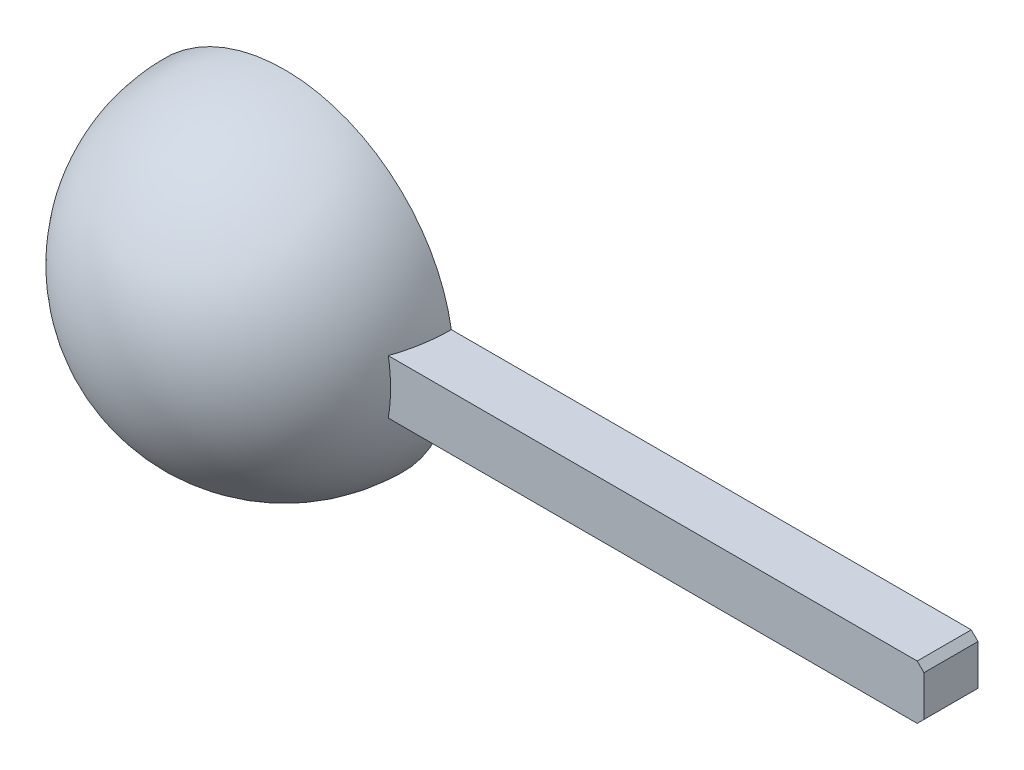
from build123d import *

# Parameters (mm, degrees)
R_VOLUTION1_ANGLE  = 180
COQUE1_T           = -2
ESQUISSE2_W        = 80
ESQUISSE2_H        = 8
BOSS_EXTRU_1_DEPTH = 8
CHANFREIN1_SIZE    = 1


with BuildPart() as part:
    # Esquisse1 → Révolution1 (revolve)
    with BuildSketch(Plane.XY):
        with BuildLine():
            Line((-25, 0), (25, 0))
            ThreePointArc((25, 0), (0, 25), (-25, 0))
        make_face()
    revolve(axis=Axis((-25, 0, 0), (1, 0, 0)), revolution_arc=R_VOLUTION1_ANGLE)

    # Coque1
    coque1_openings = [part.faces().sort_by_distance(p)[0] for p in [
        (0, 0, 0),
    ]]
    offset(amount=COQUE1_T, openings=coque1_openings)

    # Esquisse2 → Boss.-Extru.1 (add)
    with BuildSketch(Plane.XY):
        with Locations((62.649503306, 0)):
            Rectangle(ESQUISSE2_W, ESQUISSE2_H)
    extrude(amount=BOSS_EXTRU_1_DEPTH)

    # Chanfrein1
    chanfrein1_edges = [part.edges().sort_by_distance(p)[0] for p in [
        (102.649503306, 4, 4),
        (102.649503306, -4, 4),
    ]]
    chamfer(chanfrein1_edges, length=CHANFREIN1_SIZE)


solid = part.part
